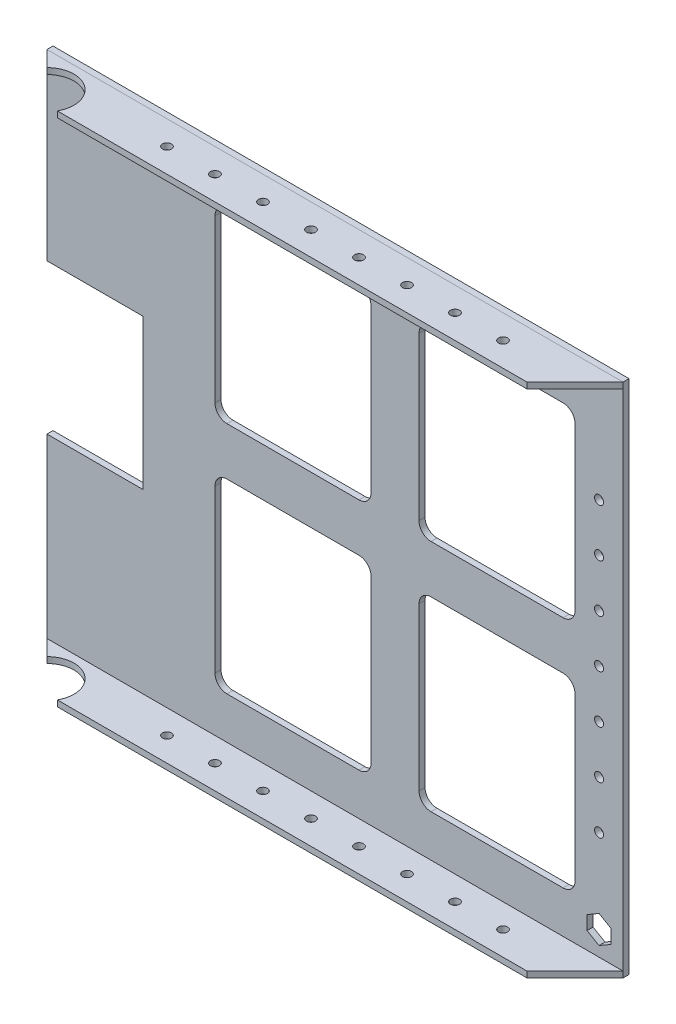
from build123d import *

# Parameters (mm, degrees)
SKETCH1_W           = 304.8
SKETCH1_H           = 273.05
BOSS_EXTRUDE1_DEPTH = 3.175
SKETCH2_W           = 50.8
SKETCH2_H           = 79.375
CUT_EXTRUDE1_DEPTH  = 3.175
SKETCH5_W           = 304.8
SKETCH5_H           = 3.175
BASE_FLANGE1_DEPTH  = 25.4
CHAMFER1_SIZE       = 25.4
SKETCH10_W          = 304.8
SKETCH10_H          = 3.175
BASE_FLANGE2_DEPTH  = 25.4
CHAMFER2_SIZE       = 25.4
SKETCH13_R          = 14.2875
CUT_EXTRUDE4_DEPTH  = 411.214423351
SKETCH19_R          = 2.38125
CUT_EXTRUDE7_DEPTH  = 411.214423351
SKETCH20_R          = 2.38125
CUT_EXTRUDE8_DEPTH  = 50.8
SKETCH21_R          = 14.2875
CUT_EXTRUDE9_DEPTH  = 3.175
CUT_EXTRUDE10_DEPTH = 411.214423351


# Sheet-metal steps are written as plain solids
with BuildPart() as part:
    # Sketch1 → Boss-Extrude1 (new body)
    with BuildSketch(Plane.XY):
        with Locations((152.4, 136.525)):
            Rectangle(SKETCH1_W, SKETCH1_H)
    extrude(amount=BOSS_EXTRUDE1_DEPTH)

    # Sketch2 → Cut-Extrude1 (cut)
    with BuildSketch(Plane.XY.offset(3.175)):
        with BuildLine():
            Line((95.25, 247.65), (165.1, 247.65))
            ThreePointArc((165.1, 247.65), (169.590128061, 245.790128061), (171.45, 241.3))
            Line((171.45, 241.3), (171.45, 155.575))
            ThreePointArc((171.45, 155.575), (169.590128061, 151.084871939), (165.1, 149.225))
            Line((165.1, 149.225), (95.25, 149.225))
            ThreePointArc((95.25, 149.225), (90.759871939, 151.084871939), (88.9, 155.575))
            Line((88.9, 155.575), (88.9, 241.3))
            ThreePointArc((88.9, 241.3), (90.759871939, 245.790128061), (95.25, 247.65))
        make_face()
        with BuildLine():
            Line((279.4, 241.3), (279.4, 155.575))
            ThreePointArc((279.4, 155.575), (277.540128061, 151.084871939), (273.05, 149.225))
            Line((273.05, 149.225), (203.2, 149.225))
            ThreePointArc((203.2, 149.225), (198.709871939, 151.084871939), (196.85, 155.575))
            Line((196.85, 155.575), (196.85, 241.3))
            ThreePointArc((196.85, 241.3), (198.709871939, 245.790128061), (203.2, 247.65))
            Line((203.2, 247.65), (273.05, 247.65))
            ThreePointArc((273.05, 247.65), (277.540128061, 245.790128061), (279.4, 241.3))
        make_face()
        with BuildLine():
            Line((95.25, 123.825), (165.1, 123.825))
            ThreePointArc((165.1, 123.825), (169.590128061, 121.965128061), (171.45, 117.475))
            Line((171.45, 117.475), (171.45, 31.75))
            ThreePointArc((171.45, 31.75), (169.590128061, 27.259871939), (165.1, 25.4))
            Line((165.1, 25.4), (95.25, 25.4))
            ThreePointArc((95.25, 25.4), (90.759871939, 27.259871939), (88.9, 31.75))
            Line((88.9, 31.75), (88.9, 117.475))
            ThreePointArc((88.9, 117.475), (90.759871939, 121.965128061), (95.25, 123.825))
        make_face()
        with BuildLine():
            Line((279.4, 117.475), (279.4, 31.75))
            ThreePointArc((279.4, 31.75), (277.540128061, 27.259871939), (273.05, 25.4))
            Line((273.05, 25.4), (203.2, 25.4))
            ThreePointArc((203.2, 25.4), (198.709871939, 27.259871939), (196.85, 31.75))
            Line((196.85, 31.75), (196.85, 117.475))
            ThreePointArc((196.85, 117.475), (198.709871939, 121.965128061), (203.2, 123.825))
            Line((203.2, 123.825), (273.05, 123.825))
            ThreePointArc((273.05, 123.825), (277.540128061, 121.965128061), (279.4, 117.475))
        make_face()
        with Locations((25.4, 136.525)):
            Rectangle(SKETCH2_W, SKETCH2_H)
    extrude(amount=-CUT_EXTRUDE1_DEPTH, mode=Mode.SUBTRACT)

    # Sketch20 → Cut-Extrude8 (cut)
    with BuildSketch(Plane(origin=(0, 0, 0), x_dir=(-1, 0, 0), z_dir=(0, 0, -1))):
        with Locations((-292.1, 136.525)):
            Circle(SKETCH20_R)
        with Locations((-292.1, 161.925)):
            Circle(SKETCH20_R)
        with Locations((-292.1, 187.325)):
            Circle(SKETCH20_R)
        with Locations((-292.1, 212.725)):
            Circle(SKETCH20_R)
        with Locations((-292.1, 111.125)):
            Circle(SKETCH20_R)
        with Locations((-292.1, 85.725)):
            Circle(SKETCH20_R)
        with Locations((-292.1, 60.325)):
            Circle(SKETCH20_R)
    extrude(amount=-CUT_EXTRUDE8_DEPTH, mode=Mode.SUBTRACT)

    # Sketch23 → Cut-Extrude10 (cut, through all)
    with BuildSketch(Plane(origin=(0, 0, 0), x_dir=(-1, 0, 0), z_dir=(0, 0, -1))):
        Polygon((-292.1, 23.207348419), (-298.45, 19.541174209), (-298.45, 12.208825791), (-292.1, 8.542651581), (-285.75, 12.208825791), (-285.75, 19.541174209), align=None)
    extrude(amount=-CUT_EXTRUDE10_DEPTH, mode=Mode.SUBTRACT)


with BuildPart() as body_2:
    # Sketch5 → Base-Flange1 (new body)
    with BuildSketch(Plane.XY.offset(3.175)):
        with Locations((152.4, 271.4625)):
            Rectangle(SKETCH5_W, SKETCH5_H)
    extrude(amount=BASE_FLANGE1_DEPTH)

    # Chamfer1
    chamfer1_edges = [body_2.edges().sort_by_distance(p)[0] for p in [
        (0, 271.4625, 28.575),
        (304.8, 271.4625, 28.575),
    ]]
    chamfer(chamfer1_edges, length=CHAMFER1_SIZE - 0.0001)  # a hair under: the kernel refuses the full size

    # Sketch13 → Cut-Extrude4 (cut, through all)
    with BuildSketch(Plane(origin=(0, 273.05, 0), x_dir=(1, 0, 0), z_dir=(0, 1, 0))):
        with Locations((18.415, -21.59)):
            Circle(SKETCH13_R)
    extrude(amount=-CUT_EXTRUDE4_DEPTH, mode=Mode.SUBTRACT)


with BuildPart() as body_3:
    # Sketch10 → Base-Flange2 (new body)
    with BuildSketch(Plane.XY.offset(3.175)):
        with Locations((152.4, 1.5875)):
            Rectangle(SKETCH10_W, SKETCH10_H)
    extrude(amount=BASE_FLANGE2_DEPTH)

    # Chamfer2
    chamfer2_edges = [body_3.edges().sort_by_distance(p)[0] for p in [
        (0, 1.5875, 28.575),
        (304.8, 1.5875, 28.575),
    ]]
    chamfer(chamfer2_edges, length=CHAMFER2_SIZE - 0.0001)  # a hair under: the kernel refuses the full size


with BuildPart() as cut_extrude7_tool:
    # Sketch19 → Cut-Extrude7 (new, through all)
    with BuildSketch(Plane(origin=(0, 273.05, 0), x_dir=(1, 0, 0), z_dir=(0, 1, 0))):
        with Locations(Location((76.2, -15.875, 0), (0, 0, 270))):
            Circle(SKETCH19_R)
        with Locations(Location((101.6, -15.875, 0), (0, 0, 270))):
            Circle(SKETCH19_R)
        with Locations(Location((127, -15.875, 0), (0, 0, 270))):
            Circle(SKETCH19_R)
        with Locations(Location((152.4, -15.875, 0), (0, 0, 270))):
            Circle(SKETCH19_R)
        with Locations(Location((177.8, -15.875, 0), (0, 0, 270))):
            Circle(SKETCH19_R)
        with Locations(Location((203.2, -15.875, 0), (0, 0, 270))):
            Circle(SKETCH19_R)
        with Locations(Location((228.6, -15.875, 0), (0, 0, 270))):
            Circle(SKETCH19_R)
        with Locations(Location((254, -15.875, 0), (0, 0, 270))):
            Circle(SKETCH19_R)
    extrude(amount=-CUT_EXTRUDE7_DEPTH)


with BuildPart() as body_2_1:
    add(body_2.part)

    # Cut-Extrude7: cut by cut_extrude7_tool
    add(cut_extrude7_tool.part, mode=Mode.SUBTRACT)


with BuildPart() as body_3_1:
    add(body_3.part)

    # Cut-Extrude7: cut by cut_extrude7_tool
    add(cut_extrude7_tool.part, mode=Mode.SUBTRACT)

    # Sketch21 → Cut-Extrude9 (cut)
    with BuildSketch(Plane(origin=(0, 3.175, 0), x_dir=(1, 0, 0), z_dir=(0, 1, 0))):
        with Locations((18.415, -21.59)):
            Circle(SKETCH21_R)
    extrude(amount=-CUT_EXTRUDE9_DEPTH, mode=Mode.SUBTRACT)


solid = Compound([part.part, body_2_1.part, body_3_1.part])
